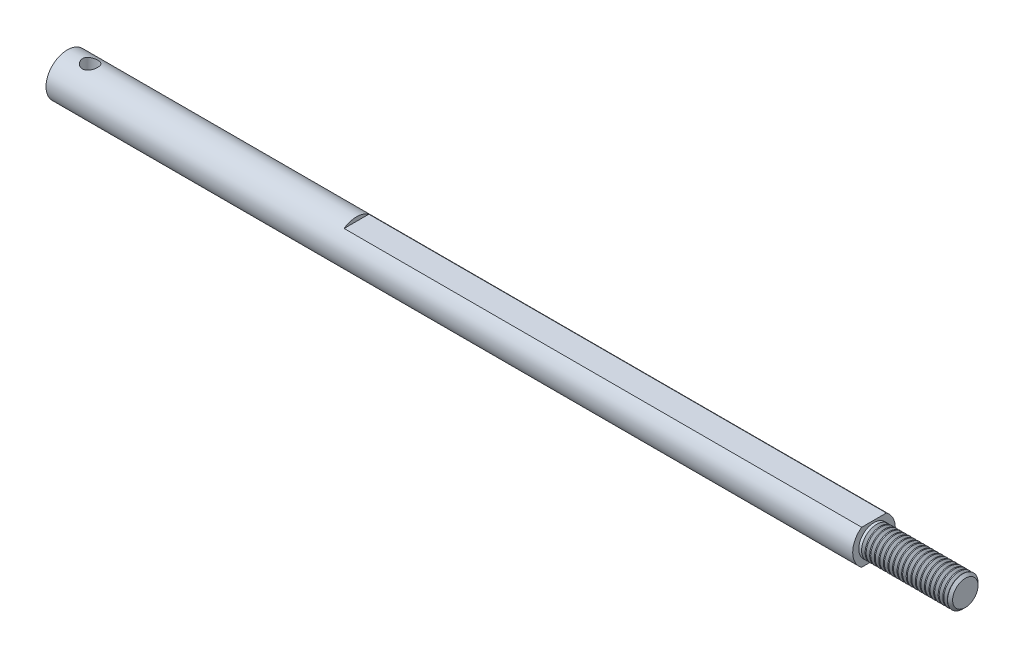
from build123d import *

# Parameters (mm, degrees)
BASEHEAD_DEPTH                      = 6.63
INDENT_OUTLINE_R                    = 7
INDENT_DEPTH                        = 0.82875
SKETCH4_W                           = 0.6
SKETCH4_H                           = 11.237604307
THDSCHPAT_COUNT                     = 19
THDSCHPAT_PITCH                     = 1.5
SKETCH7_R                           = 13.935804787
CUT_EXTRUDE1_DEPTH                  = 10
SKETCH8_R                           = 7
BOSS_EXTRUDE1_DEPTH                 = 265
SKETCH9_W                           = 14.54473127
SKETCH9_H                           = 2.205507465
CUT_EXTRUDE2_DEPTH                  = 170
CUT_EXTRUDE3_REACH                  = 260.56
CUT_EXTRUDE3_END_RADIUS             = 7
SKETCH10_R                          = 2.5
CUT_EXTRUDE3_DIRECTION_2_REACH      = 260.56
CUT_EXTRUDE3_DIRECTION_2_END_RADIUS = 7


# Read off the part's stored shape, not the designer's step: Indent
with BuildPart() as part:
    # Sketch1 → BaseHead (new body)
    with BuildSketch(Plane(origin=(0, 0, 0), x_dir=(0, 0, -1), z_dir=(1, 0, 0))):
        Polygon((8, 4.618802154), (8, -4.618802154), (0, -9.237604307), (-8, -4.618802154), (-8, 4.618802154), (0, 9.237604307), align=None)
    extrude(amount=BASEHEAD_DEPTH)

    # BodySke → BaseBody (revolve)
    with BuildSketch(Plane.XY, mode=Mode.PRIVATE) as basebody_sk:
        Polygon((0, 0), (36.63, 0), (36.63, 4.172), (35.802, 5), (0, 5), align=None)
    revolve(basebody_sk.sketch.rotate(Axis((0, 0, 0), (1, 0, 0)), 90), axis=Axis((0, 0, 0), (1, 0, 0)))

    # Indent outline → Indent (cut)
    with BuildSketch(Plane.YZ):
        with Locations((0.192376607, 0.033212245)):
            Circle(INDENT_OUTLINE_R)
    extrude(amount=INDENT_DEPTH, mode=Mode.SUBTRACT)

    # Sketch3 → HeadChamfer (revolve, cut)
    with BuildSketch(Plane.XY):
        Polygon((0, 8), (3.601282526, 14.237604307), (3.601282526, 19.237604307), (-10, 19.237604307), (-10, 8), align=None)
    revolve(axis=Axis((0, 0, 0), (1, 0, 0)), mode=Mode.SUBTRACT)

    # Sketch4 → BearingFace (revolve, cut)
    with BuildSketch(Plane.XY, mode=Mode.PRIVATE) as bearingface_sk:
        with Locations((6.33, 13.618802154)):
            Rectangle(SKETCH4_W, SKETCH4_H)
    revolve(bearingface_sk.sketch.rotate(Axis((0, 0, 0), (1, 0, 0)), 270), axis=Axis((0, 0, 0), (1, 0, 0)), mode=Mode.SUBTRACT)

    # ThdSchSke → ThreadSchematic (revolve, cut)
    with BuildSketch(Plane.XY):
        Polygon((8.13, -4.172), (7.550228158, -5), (7.550228158, -6.25), (8.709771842, -6.25), (8.709771842, -5), align=None)
    threadschematic = revolve(axis=Axis((-3.175, 0, 0), (1, 0, 0)), mode=Mode.SUBTRACT)

    # ThdSchPat: ThreadSchematic ×19
    with Locations(*[(i * THDSCHPAT_PITCH, 0, 0) for i in range(1, THDSCHPAT_COUNT)]):
        add(threadschematic, mode=Mode.SUBTRACT)

    # Sketch7 → Cut-Extrude1 (cut)
    with BuildSketch(Plane(origin=(6.63, 0, 0), x_dir=(0, 0, -1), z_dir=(1, 0, 0))):
        Circle(SKETCH7_R)
    extrude(amount=-CUT_EXTRUDE1_DEPTH, mode=Mode.SUBTRACT)

    # Sketch8 → Boss-Extrude1 (add)
    with BuildSketch(Plane.ZY.offset(-6.63)):
        Circle(SKETCH8_R)
    extrude(amount=BOSS_EXTRUDE1_DEPTH)

    # Sketch9 → Cut-Extrude2 (cut)
    with BuildSketch(Plane(origin=(6.63, 0, 0), x_dir=(0, 0, -1), z_dir=(1, 0, 0))):
        with Locations((-1.022041736, -6.802753733)):
            Rectangle(SKETCH9_W, SKETCH9_H)
        with Locations((-1.022041736, 6.802753733)):
            Rectangle(SKETCH9_W, SKETCH9_H)
    extrude(amount=-CUT_EXTRUDE2_DEPTH, mode=Mode.SUBTRACT)

    # Cut-Extrude3: up to this cylinder (the profile starts inside it)
    cut_extrude3_end = Plane(origin=(-250.87, 0, 0), z_dir=(1, 0, 0)) * Cylinder(CUT_EXTRUDE3_END_RADIUS, 536.12, mode=Mode.PRIVATE)
    # Sketch10 → Cut-Extrude3 (cut, up to the surface)
    with BuildSketch(Plane(origin=(0, 0, 0), x_dir=(1, 0, 0), z_dir=(0, 1, 0)), mode=Mode.PRIVATE) as cut_extrude3_sk1:
        with Locations(Location((-250.87, 0, 0), (0, 0, 90))):
            Circle(SKETCH10_R)
    cut_extrude3_tool1 = extrude(cut_extrude3_sk1.sketch, amount=-CUT_EXTRUDE3_REACH, mode=Mode.PRIVATE) & cut_extrude3_end
    add(cut_extrude3_tool1.solids().sort_by_distance((-250.87, 0, 0))[0], mode=Mode.SUBTRACT)

    # Cut-Extrude3 direction 2: up to this cylinder (the profile starts inside it)
    cut_extrude3_direction_2_end = Plane(origin=(-250.87, 0, 0), z_dir=(1, 0, 0)) * Cylinder(CUT_EXTRUDE3_DIRECTION_2_END_RADIUS, 536.12, mode=Mode.PRIVATE)
    # Sketch10 → Cut-Extrude3 direction 2 (cut, up to the surface)
    with BuildSketch(Plane(origin=(0, 0, 0), x_dir=(1, 0, 0), z_dir=(0, 1, 0)), mode=Mode.PRIVATE) as cut_extrude3_direction_2_sk1:
        with Locations(Location((-250.87, 0, 0), (0, 0, 90))):
            Circle(SKETCH10_R)
    cut_extrude3_direction_2_tool1 = extrude(cut_extrude3_direction_2_sk1.sketch, amount=CUT_EXTRUDE3_DIRECTION_2_REACH, mode=Mode.PRIVATE) & cut_extrude3_direction_2_end
    add(cut_extrude3_direction_2_tool1.solids().sort_by_distance((-250.87, 0, 0))[0], mode=Mode.SUBTRACT)


solid = part.part
